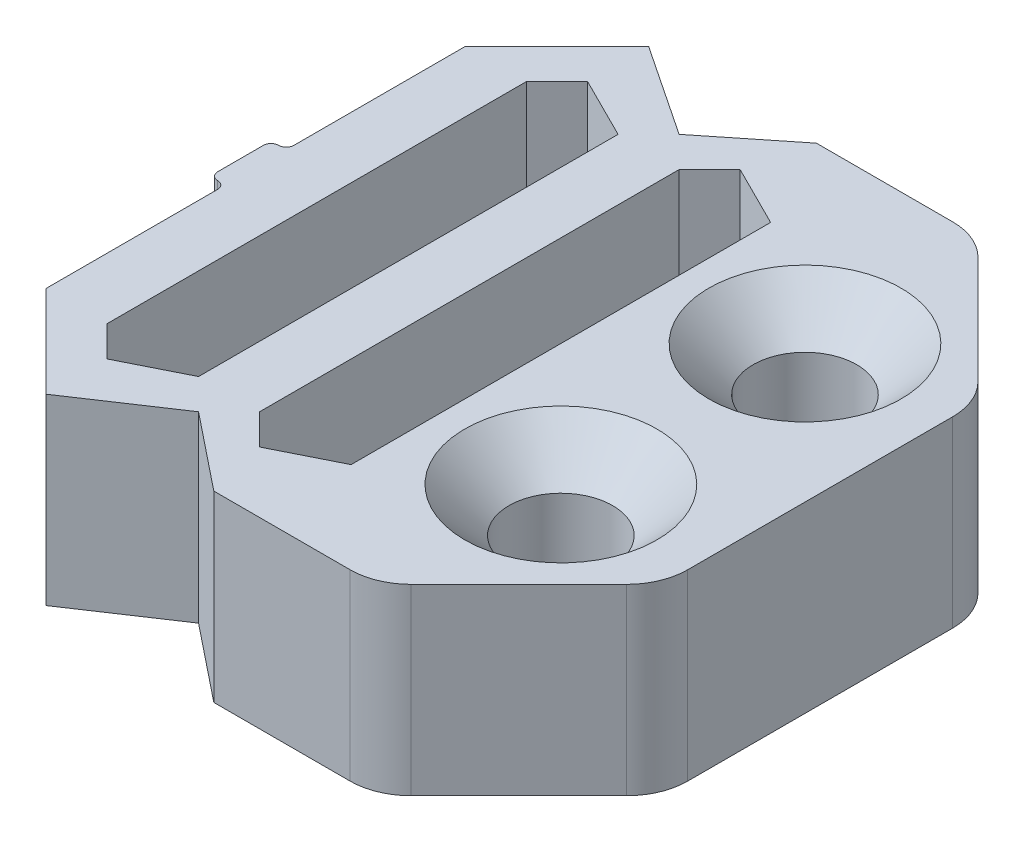
from build123d import *

# Parameters (mm, degrees)
BOSS_EXTRUDE1_DEPTH                                 = 3
FILLET1_R                                           = 2
CSK_FOR_M3_COUNTERSUNK_FLAT_HEAD_SCREW1_D           = 3.4
CSK_FOR_M3_COUNTERSUNK_FLAT_HEAD_SCREW1_CSINK_D     = 6.3
CSK_FOR_M3_COUNTERSUNK_FLAT_HEAD_SCREW1_CSINK_ANGLE = 90
FILLET2_R                                           = 0.25


with BuildPart() as part:
    # Sketch1 → Boss-Extrude1 (new, symmetric)
    with BuildSketch(Plane(origin=(0, 0, 0), x_dir=(1, 0, 0), z_dir=(0, 1, 0))):
        Polygon((-1.75, -9.875), (3.546572875, -9.875), (8.25, -5.171572875), (8.25, 5.171572875), (3.546572875, 9.875), (-1.75, 9.875), (-4.25, 7.875), (-7.25, 9.875), (-10.25, 6.875), (-10.25, 1), (-10.75, 1), (-10.75, -1), (-10.25, -1), (-10.25, -6.875), (-7.25, -9.875), (-4.25, -7.875), align=None)
        Polygon((-8.25, -6.875), (-8.25, 6.875), (-7.25, 7.875), (-5.25, 6.875), (-5.25, -6.875), (-7.25, -7.875), align=None, mode=Mode.SUBTRACT)
        Polygon((-3.25, -6.875), (-3.25, 6.875), (-2.25, 7.875), (-0.25, 6.875), (-0.25, -6.875), (-2.25, -7.875), align=None, mode=Mode.SUBTRACT)
    extrude(amount=BOSS_EXTRUDE1_DEPTH, both=True)

    # Fillet1
    fillet1_edges = [part.edges().sort_by_distance(p)[0] for p in [
        (3.546572875, 0, -9.875),
        (8.25, 0, -5.171572875),
        (8.25, 0, 5.171572875),
        (3.546572875, 0, 9.875),
    ]]
    fillet(fillet1_edges, radius=FILLET1_R)

    # CSK for M3 Countersunk Flat Head Screw1 (through all)
    with Locations(Plane(origin=(0, 3, 0), x_dir=(1, 0, 0), z_dir=(0, 1, 0))):
        with Locations((3.75, 4), (3.75, -4)):
            CounterSinkHole(CSK_FOR_M3_COUNTERSUNK_FLAT_HEAD_SCREW1_D / 2, CSK_FOR_M3_COUNTERSUNK_FLAT_HEAD_SCREW1_CSINK_D / 2, counter_sink_angle=CSK_FOR_M3_COUNTERSUNK_FLAT_HEAD_SCREW1_CSINK_ANGLE)

    # Fillet2
    fillet2_edges = [part.edges().sort_by_distance(p)[0] for p in [
        (-10.25, 0, -1),
        (-10.25, 0, 1),
    ]]
    fillet(fillet2_edges, radius=FILLET2_R)
    fillet2_2_edges = [part.edges().sort_by_distance(p)[0] for p in [
        (-10.75, 0, -1),
        (-10.75, 0, 1),
    ]]
    fillet(fillet2_2_edges, radius=FILLET2_R - 0.0001)  # a hair under: the kernel refuses the full size


solid = part.part
